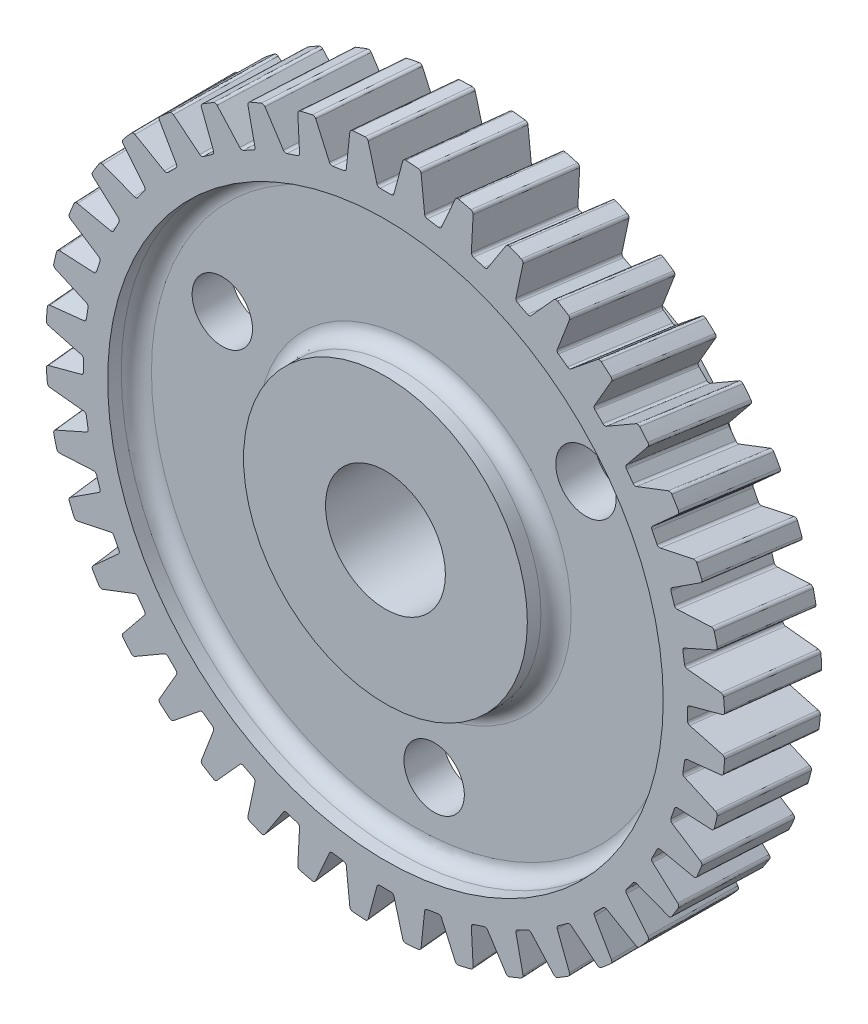
from build123d import *

# Parameters (mm, degrees)
FILLET1_R                = 1
CIRPATTERN1_COUNT        = 40
FILLET2_R                = 0.2
F_4_0_4_DIAMETER_HOLE1_D = 4


with BuildPart() as part:
    # Sketch2 → Revolve1 (revolve)
    with BuildSketch(Plane(origin=(0, 0, 0), x_dir=(0, 0, -1), z_dir=(1, 0, 0))):
        Polygon((11, 3.96875), (-3.2, 3.96875), (-3.2, 9.4), (-1.3, 9.4), (-1.3, 18.4), (-3.2, 18.4), (-3.2, 22.5), (3.2, 22.5), (3.2, 18.4), (1.3, 18.4), (1.3, 9.4), (3.2, 9.4), (11, 9.4), align=None)
    revolve(axis=Axis((0, 0, 0), (0, 0, -1)))

    # Fillet1
    fillet1_edges = [part.edges().sort_by_distance(p)[0] for p in [
        (0, -18.4, 1.3),
        (0, -9.4, 1.3),
        (0, -9.4, -1.3),
        (0, -18.4, -1.3),
    ]]
    fillet(fillet1_edges, radius=FILLET1_R)

    # Cut-Sweep1: sweep along a path in Sketch4
    with BuildLine(Plane(origin=(0, 0, 0), x_dir=(1, 0, 0), z_dir=(0, 1, 0))) as cut_sweep1_path:
        Line((0, -3.2), (0.690971205, 3.2))
    # Sketch3 → Cut-Sweep1 (sweep, cut)
    with BuildSketch(Plane.XY.offset(3.2)):
        Polygon((-0.525, 20), (0.525, 20), (1.246362285, 22.6921607), (-1.246362285, 22.6921607), align=None)
    cut_sweep1 = sweep(path=cut_sweep1_path.line, mode=Mode.SUBTRACT)

    # CirPattern1: Cut-Sweep1 ×40 about axis
    cirpattern1_axis = Axis((0, 0, 3.2), (0, 0, 1))
    for i in range(1, CIRPATTERN1_COUNT):
        add(cut_sweep1.rotate(cirpattern1_axis, i * 360 / CIRPATTERN1_COUNT), mode=Mode.SUBTRACT)

    # Fillet2
    fillet2_edges = [part.edges().sort_by_distance(p)[0] for p in [
        (1.526462518, 22.448160552, 5.3054e-05),
        (0.870485603, 20, 0),
        (-0.845126217, 22.484122435, -6.2808e-05),
        (-2.003996756, 22.410577793, 5.3054e-05),
        (-2.26892082, 19.889940761, 0),
        (-3.305993578, 19.725684573, 0),
        (-4.352012976, 22.07509871, -6.2808e-05),
        (-5.485110979, 21.821172231, 5.3054e-05),
        (-5.352458883, 19.29012517, 0),
        (-6.351068225, 18.965657326, 0),
        (-7.751738732, 21.122512792, -6.2808e-05),
        (-8.831163565, 20.694456989, 5.3054e-05),
        (-8.304201644, 18.215322678, 0),
        (-9.239758494, 17.738632653, 0),
        (-10.960590953, 19.649820507, -6.2808e-05),
        (-11.959763596, 19.058175535, 5.3054e-05),
        (-11.0514674, 16.691998487, 0),
        (-11.900935244, 16.074823972, 0),
        (-13.89955705, 17.693284427, -6.2808e-05),
        (-14.793874554, 16.952618549, 5.3054e-05),
        (-13.526609351, 14.757661896, 0),
        (-14.269071471, 14.015199776, 0),
        (-16.496269922, 15.301080964, -6.2808e-05),
        (-17.263711223, 14.429631832, 5.3054e-05),
        (-15.668681288, 12.459942692, 0),
        (-16.285855803, 11.610474848, 0),
        (-18.68678988, 12.532114106, -6.2808e-05),
        (-19.308458027, 11.55133969, 5.3054e-05),
        (-17.42493829, 9.855418346, 0),
        (-17.901628315, 8.919861496, 0),
        (-20.417179054, 9.454565008, -6.2808e-05),
        (-20.877766513, 8.388615227, 5.3054e-05),
        (-18.752135481, 7.008220892, 0),
        (-19.076603325, 6.00961155, 0),
        (-21.644829518, 6.144213141, -6.2808e-05),
        (-21.932995098, 5.019335218, 5.3054e-05),
        (-19.617592862, 3.988457781, 0),
        (-19.781849051, 2.951385024, 0),
        (-22.339512445, 2.682570354, -6.2808e-05),
        (-22.448160552, 1.526462518, 5.3054e-05),
        (-20, 0.870485603, 0),
        (-20, -0.179514397, 0),
        (-22.484122435, -0.845126217, -6.2808e-05),
        (-22.410577793, -2.003996756, 5.3054e-05),
        (-19.889940761, -2.26892082, 0),
        (-19.725684573, -3.305993578, 0),
        (-22.07509871, -4.352012976, -6.2808e-05),
        (-21.821172231, -5.485110979, 5.3054e-05),
        (-19.29012517, -5.352458883, 0),
        (-18.965657326, -6.351068225, 0),
        (-21.122512792, -7.751738732, -6.2808e-05),
        (-20.694456989, -8.831163565, 5.3054e-05),
        (-18.215322678, -8.304201644, 0),
        (-17.738632653, -9.239758494, 0),
        (-19.649820507, -10.960590953, -6.2808e-05),
        (-19.058175535, -11.959763596, 5.3054e-05),
        (-16.691998487, -11.0514674, 0),
        (-16.074823972, -11.900935244, 0),
        (-17.693284427, -13.89955705, -6.2808e-05),
        (-16.952618549, -14.793874554, 5.3054e-05),
        (-14.757661896, -13.526609351, 0),
        (-14.015199776, -14.269071471, 0),
        (-15.301080964, -16.496269922, -6.2808e-05),
        (-14.429631832, -17.263711223, 5.3054e-05),
        (-12.459942692, -15.668681288, 0),
        (-11.610474848, -16.285855803, 0),
        (-12.532114106, -18.68678988, -6.2808e-05),
        (-11.55133969, -19.308458027, 5.3054e-05),
        (-9.855418346, -17.42493829, 0),
        (-8.919861496, -17.901628315, 0),
        (-9.454565008, -20.417179054, -6.2808e-05),
        (-8.388615227, -20.877766513, 5.3054e-05),
        (-7.008220892, -18.752135481, 0),
        (-6.00961155, -19.076603325, 0),
        (-6.144213141, -21.644829518, -6.2808e-05),
        (-5.019335218, -21.932995098, 5.3054e-05),
        (-3.988457781, -19.617592862, 0),
        (-2.951385024, -19.781849051, 0),
        (-2.682570354, -22.339512445, -6.2808e-05),
        (-1.526462518, -22.448160552, 5.3054e-05),
        (-0.870485603, -20, 0),
        (0.179514397, -20, 0),
        (0.845126217, -22.484122435, -6.2808e-05),
        (2.003996756, -22.410577793, 5.3054e-05),
        (2.26892082, -19.889940761, 0),
        (3.305993578, -19.725684573, 0),
        (4.352012976, -22.07509871, -6.2808e-05),
        (5.485110979, -21.821172231, 5.3054e-05),
        (5.352458883, -19.29012517, 0),
        (6.351068225, -18.965657326, 0),
        (7.751738732, -21.122512792, -6.2808e-05),
        (8.831163565, -20.694456989, 5.3054e-05),
        (8.304201644, -18.215322678, 0),
        (9.239758494, -17.738632653, 0),
        (10.960590953, -19.649820507, -6.2808e-05),
        (11.959763596, -19.058175535, 5.3054e-05),
        (11.0514674, -16.691998487, 0),
        (11.900935244, -16.074823972, 0),
        (13.89955705, -17.693284427, -6.2808e-05),
        (14.793874554, -16.952618549, 5.3054e-05),
        (13.526609351, -14.757661896, 0),
        (14.269071471, -14.015199776, 0),
        (16.496269922, -15.301080964, -6.2808e-05),
        (17.263711223, -14.429631832, 5.3054e-05),
        (15.668681288, -12.459942692, 0),
        (16.285855803, -11.610474848, 0),
        (18.68678988, -12.532114106, -6.2808e-05),
        (19.308458027, -11.55133969, 5.3054e-05),
        (17.42493829, -9.855418346, 0),
        (17.901628315, -8.919861496, 0),
        (20.417179054, -9.454565008, -6.2808e-05),
        (20.877766513, -8.388615227, 5.3054e-05),
        (18.752135481, -7.008220892, 0),
        (19.076603325, -6.00961155, 0),
        (21.644829518, -6.144213141, -6.2808e-05),
        (21.932995098, -5.019335218, 5.3054e-05),
        (19.617592862, -3.988457781, 0),
        (19.781849051, -2.951385024, 0),
        (22.339512445, -2.682570354, -6.2808e-05),
        (22.448160552, -1.526462518, 5.3054e-05),
        (20, -0.870485603, 0),
        (20, 0.179514397, 0),
        (22.484122435, 0.845126217, -6.2808e-05),
        (22.410577793, 2.003996756, 5.3054e-05),
        (19.889940761, 2.26892082, 0),
        (19.725684573, 3.305993578, 0),
        (22.07509871, 4.352012976, -6.2808e-05),
        (21.821172231, 5.485110979, 5.3054e-05),
        (19.29012517, 5.352458883, 0),
        (18.965657326, 6.351068225, 0),
        (21.122512792, 7.751738732, -6.2808e-05),
        (20.694456989, 8.831163565, 5.3054e-05),
        (18.215322678, 8.304201644, 0),
        (17.738632653, 9.239758494, 0),
        (19.649820507, 10.960590953, -6.2808e-05),
        (19.058175535, 11.959763596, 5.3054e-05),
        (16.691998487, 11.0514674, 0),
        (16.074823972, 11.900935244, 0),
        (17.693284427, 13.89955705, -6.2808e-05),
        (16.952618549, 14.793874554, 5.3054e-05),
        (14.757661896, 13.526609351, 0),
        (14.015199776, 14.269071471, 0),
        (15.301080964, 16.496269922, -6.2808e-05),
        (14.429631832, 17.263711223, 5.3054e-05),
        (12.459942692, 15.668681288, 0),
        (11.610474848, 16.285855803, 0),
        (12.532114106, 18.68678988, -6.2808e-05),
        (11.55133969, 19.308458027, 5.3054e-05),
        (9.855418346, 17.42493829, 0),
        (8.919861496, 17.901628315, 0),
        (9.454565008, 20.417179054, -6.2808e-05),
        (8.388615227, 20.877766513, 5.3054e-05),
        (7.008220892, 18.752135481, 0),
        (6.00961155, 19.076603325, 0),
        (6.144213141, 21.644829518, -6.2808e-05),
        (5.019335218, 21.932995098, 5.3054e-05),
        (3.988457781, 19.617592862, 0),
        (2.951385024, 19.781849051, 0),
        (2.682570354, 22.339512445, -6.2808e-05),
        (-0.179514397, 20, 0),
    ]]
    fillet(fillet2_edges, radius=FILLET2_R)

    # Ø4.0 (4) Diameter Hole1 (through all)
    with Locations(Plane(origin=(59.759048418, -178.20301315, 3.9366), x_dir=(0.9999854958897523, -0.005385908477352911, 0), z_dir=(0, 0, 1))):
        with Locations((-73.454863948, 183.614199593), (-49.382318749, 186.041234274), (-59.31671766, 163.980281258)):
            Hole(F_4_0_4_DIAMETER_HOLE1_D / 2)


solid = part.part
